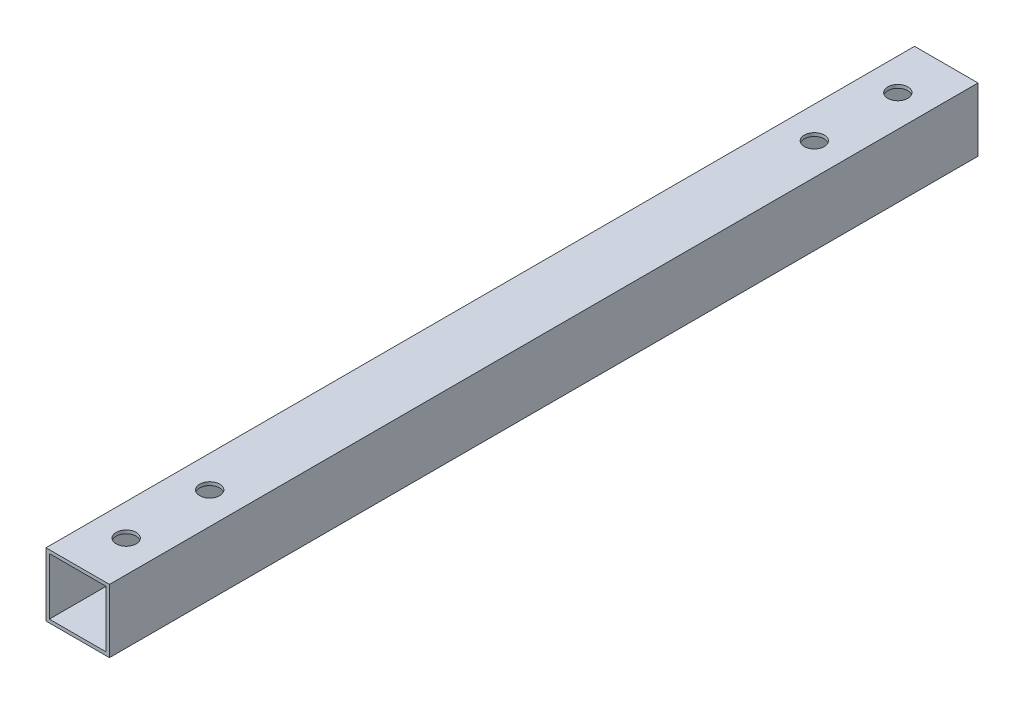
from build123d import *

# Parameters (mm, degrees)
ESBO_O1_W                = 19
ESBO_O1_H                = 19
RESSALTO_EXTRUS_O1_DEPTH = 260
CASCA2_T                 = -1
ESBO_O2_R                = 3
CORTE_EXTRUS_O1_DEPTH    = 261.866345089


with BuildPart() as part:
    # Esboço1 → Ressalto-extrusão1 (new body)
    with BuildSketch(Plane.XY):
        Rectangle(ESBO_O1_W, ESBO_O1_H)
    extrude(amount=RESSALTO_EXTRUS_O1_DEPTH)

    # Casca2
    casca2_openings = [part.faces().sort_by_distance(p)[0] for p in [
        (0, 0, 0),
        (0, 0, 260),
    ]]
    offset(amount=CASCA2_T, openings=casca2_openings, kind=Kind.INTERSECTION)

    # Esboço2 → Corte-extrusão1 (cut, through all)
    with BuildSketch(Plane(origin=(0, 9.5, 0), x_dir=(1, 0, 0), z_dir=(0, 1, 0))):
        with Locations((0, -220.5)):
            Circle(ESBO_O2_R)
        with Locations((0, -245.5)):
            Circle(ESBO_O2_R)
        with Locations((0, -14.5)):
            Circle(ESBO_O2_R)
        with Locations((0, -39.5)):
            Circle(ESBO_O2_R)
    extrude(amount=-CORTE_EXTRUS_O1_DEPTH, mode=Mode.SUBTRACT)


solid = part.part
